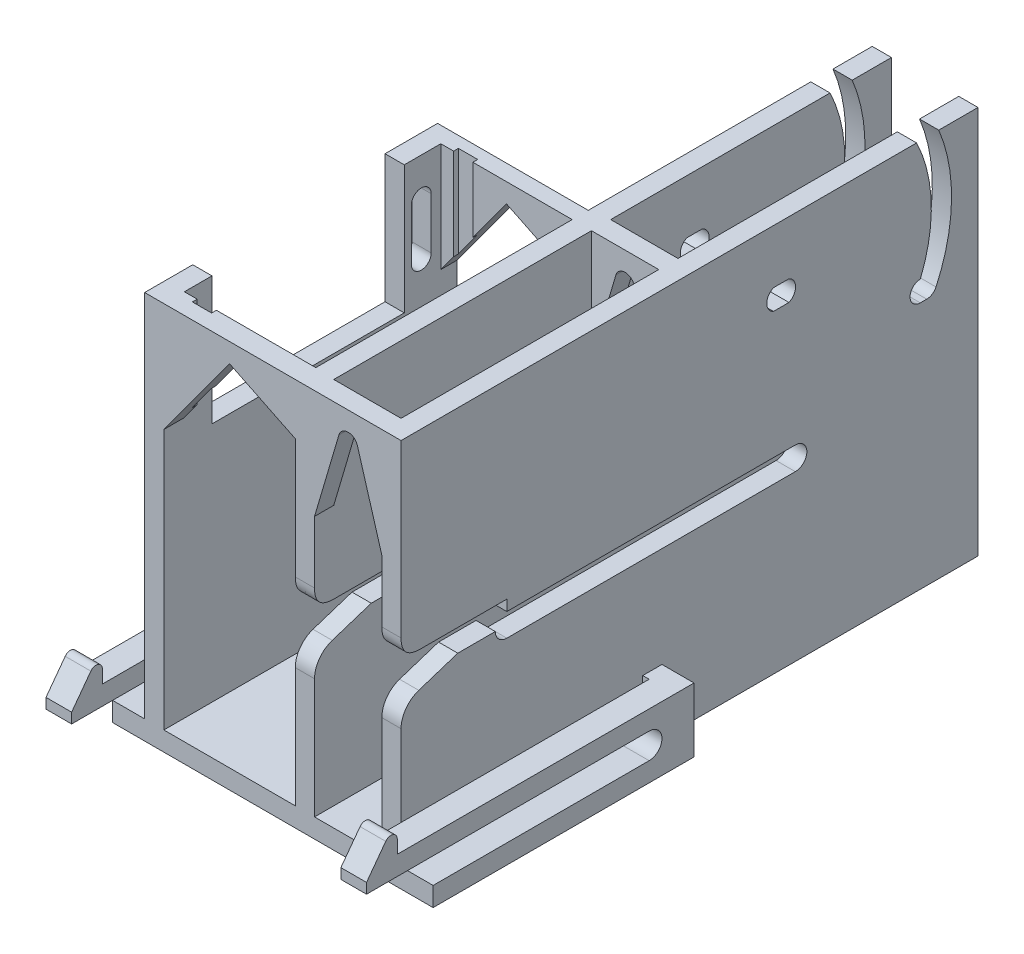
from build123d import *

# Parameters (mm, degrees)
SKETCH1_W                    = 20.5
SKETCH1_H                    = 3
SKETCH1_W_2                  = 3
SKETCH1_W_3                  = 10.5
SKETCH1_H_2                  = 2
MAIN_EXTRUDE_DEPTH           = 90
SWITCH_LEVER_START           = -16.5
SWITCH_LEVER_HOLES_DEPTH     = 16.5
SERVO_START                  = -23.5
SKETCH3_W                    = 30
SKETCH3_H                    = 20
SKETCH3_W_2                  = 44.3
SKETCH3_H_2                  = 60.6
SERVO_MOUNT_SLOTS_DEPTH      = 23.5
SERVO_HOLE_EXPANSION_REACH   = 70.75
SKETCH4_W                    = 20.5
SKETCH4_H                    = 8
SERVO_HOLE_EXPANSION_2_REACH = 115.051
SKETCH5_W                    = 20.5
SKETCH5_H                    = 40
SKETCH5_W_2                  = 10.5
SKETCH5_H_2                  = 12
SKETCH5_H_3                  = 68
TAB1_DEPTH                   = 5
TAB2_START                   = -45
TAB2_DEPTH                   = 5
TAB_SPACER_REACH             = 124.885
SKETCH7_W                    = 1
SKETCH7_H                    = 48.088
LEVER_SHELF_DEPTH            = 10.5
SKETCH10_W                   = 10.5
SKETCH10_H                   = 3.45
CUT_EXTRUDE2_DEPTH           = 45
BOSS_EXTRUDE1_DEPTH          = 3
BOSS_EXTRUDE2_START          = -43.2
BOSS_EXTRUDE2_DEPTH          = 3
FILLET1_SIZE                 = 3
CUT_EXTRUDE3_REACH           = 124.885
SKETCH12_W                   = 3
SKETCH12_H                   = 0.75
CUT_EXTRUDE4_REACH           = 116.801
FILLET2_R                    = 4


with BuildPart() as part:
    # Sketch1 → Main Extrude (new body)
    with BuildSketch(Plane.XY):
        Polygon((-8.25, 32.811469611), (-28.75, 32.811469611), (-28.75, 15.811469611), (-18.5, 29.811469611), (-8.25, 24.811469611), align=None)
        Polygon((-28.75, 15.811469611), (-28.75, 32.811469611), (-31.75, 32.811469611), (-31.75, -24.788530389), (-28.75, -24.788530389), align=None)
        with Locations((-18.5, -26.288530389)):
            Rectangle(SKETCH1_W, SKETCH1_H)
        with Locations((-30.25, -26.288530389)):
            Rectangle(SKETCH1_W_2, SKETCH1_H)
        with Locations((-6.75, -26.288530389)):
            Rectangle(SKETCH1_W_2, SKETCH1_H)
        Polygon((-5.25, 32.811469611), (-8.25, 32.811469611), (-8.25, 24.811469611), (-8.25, -24.788530389), (-5.25, -24.788530389), (-5.25, 3.911469611), (-5.25, 5.911469611), align=None)
        with Locations((0, -26.288530389)):
            Rectangle(SKETCH1_W_3, SKETCH1_H)
        with Locations((6.75, -26.288530389)):
            Rectangle(SKETCH1_W_2, SKETCH1_H)
        Polygon((5.25, 32.811469611), (5.25, 5.911469611), (5.25, 3.911469611), (5.25, -24.788530389), (8.25, -24.788530389), (8.25, 32.811469611), align=None)
        with Locations((0, 4.911469611)):
            Rectangle(SKETCH1_W_3, SKETCH1_H_2)
    extrude(amount=MAIN_EXTRUDE_DEPTH)

    # Sketch2 → Switch/Lever Holes (cut)
    with BuildSketch(Plane(origin=(8.25, 0, 0), x_dir=(0, 0, -1), z_dir=(1, 0, 0)).offset(SWITCH_LEVER_START)):
        with BuildLine():
            Line((-90, -0.338530389), (-75.3, -0.338530389))
            ThreePointArc((-75.3, -0.338530389), (-74.772792206, -1.611322596), (-73.5, -2.138530389))
            Line((-73.5, -2.138530389), (-28.5, -2.138530389))
            ThreePointArc((-28.5, -2.138530389), (-26.7, -0.338530389), (-28.5, 1.461469611))
            Line((-28.5, 1.461469611), (-73.5, 1.461469611))
            Line((-73.5, 1.461469611), (-73.5, 3.136469611))
            Line((-73.5, 3.136469611), (-90, 3.136469611))
            Line((-90, 3.136469611), (-90, -0.338530389))
        make_face()
        with BuildLine():
            Line((-29.491127656, 24.411469611), (-31.908872344, 24.411469611))
            ThreePointArc((-31.908872344, 24.411469611), (-32.95, 22.811469611), (-31.908872344, 21.211469611))
            Line((-31.908872344, 21.211469611), (-29.491127656, 21.211469611))
            ThreePointArc((-29.491127656, 21.211469611), (-28.45, 22.811469611), (-29.491127656, 24.411469611))
        make_face()
        with BuildLine():
            Line((-9, 10.911469611), (-8, 10.911469611))
            ThreePointArc((-8, 10.911469611), (-7.139020973, 11.162872148), (-6.548607336, 11.838075717))
            ThreePointArc((-6.548607336, 11.838075717), (-4.132373754, 22.279858493), (-6.120885638, 32.811469611))
            Line((-6.120885638, 32.811469611), (-9.58131915, 32.811469611))
            ThreePointArc((-9.58131915, 32.811469611), (-7.295349446, 23.52349699), (-9, 14.111469611))
            ThreePointArc((-9, 14.111469611), (-10.6, 12.511469611), (-9, 10.911469611))
        make_face()
    extrude(amount=SWITCH_LEVER_HOLES_DEPTH, mode=Mode.SUBTRACT)

    # Sketch3 → Servo Mount Slots (cut)
    with BuildSketch(Plane.ZY.offset(31.75).offset(SERVO_START)):
        with Locations((67.5, 22.811469611)):
            Rectangle(SKETCH3_W, SKETCH3_H)
        with BuildLine():
            Line((51.4, 26.811469611), (51.4, 18.811469611))
            ThreePointArc((51.4, 18.811469611), (49.85, 17.261469611), (48.3, 18.811469611))
            Line((48.3, 18.811469611), (48.3, 26.811469611))
            ThreePointArc((48.3, 26.811469611), (49.85, 28.361469611), (51.4, 26.811469611))
        make_face()
        with BuildLine():
            Line((86.7, 26.811469611), (86.7, 18.811469611))
            ThreePointArc((86.7, 18.811469611), (85.15, 17.261469611), (83.6, 18.811469611))
            Line((83.6, 18.811469611), (83.6, 26.811469611))
            ThreePointArc((83.6, 26.811469611), (85.15, 28.361469611), (86.7, 26.811469611))
        make_face()
        with Locations((22.15, 2.511469611)):
            Rectangle(SKETCH3_W_2, SKETCH3_H_2)
    extrude(amount=SERVO_MOUNT_SLOTS_DEPTH, mode=Mode.SUBTRACT)

    # Servo Hole Expansion: up to this face of the body (flat: up to its plane)
    servo_hole_expansion_end = Plane(part.part.faces().sort_by_distance((-9.616666667, 26.144802944, 83.6))[0])
    # Sketch4 → Servo Hole Expansion (cut, up to the picked face)
    with BuildSketch(Plane(origin=(0, 0, 51.4), x_dir=(-1, 0, 0), z_dir=(0, 0, -1)), mode=Mode.PRIVATE) as servo_hole_expansion_sk1:
        with Locations((18.5, 28.811469611)):
            Rectangle(SKETCH4_W, SKETCH4_H)
    servo_hole_expansion_tool1 = split(extrude(servo_hole_expansion_sk1.sketch, amount=-SERVO_HOLE_EXPANSION_REACH, mode=Mode.PRIVATE), bisect_by=servo_hole_expansion_end, keep=Keep.BOTH, mode=Mode.PRIVATE)
    add(servo_hole_expansion_tool1.solids().sort_by(Axis((-18.5, 28.81147, 51.4), (0, 0, 1)))[0], mode=Mode.SUBTRACT)

    # Servo Hole Expansion 2: up to this face of the body (flat: up to its plane)
    servo_hole_expansion_2_end = Plane(part.part.faces().sort_by_distance((-18.5, -24.788530389, 67.15))[0])
    # Sketch5 → Servo Hole Expansion 2 (cut, up to the picked face)
    with BuildSketch(Plane(origin=(0, 32.811469611, 0), x_dir=(1, 0, 0), z_dir=(0, 1, 0)), mode=Mode.PRIVATE) as servo_hole_expansion_2_sk1:
        with Locations((-18.5, -66.8)):
            Rectangle(SKETCH5_W, SKETCH5_H)
    servo_hole_expansion_2_tool1 = split(extrude(servo_hole_expansion_2_sk1.sketch, amount=-SERVO_HOLE_EXPANSION_2_REACH, mode=Mode.PRIVATE), bisect_by=servo_hole_expansion_2_end, keep=Keep.BOTH, mode=Mode.PRIVATE)
    # Sketch5 → Servo Hole Expansion 2 (cut, up to the picked face)
    with BuildSketch(Plane(origin=(0, 32.811469611, 0), x_dir=(1, 0, 0), z_dir=(0, 1, 0)), mode=Mode.PRIVATE) as servo_hole_expansion_2_sk2:
        with Locations((0, -6)):
            Rectangle(SKETCH5_W_2, SKETCH5_H_2)
    servo_hole_expansion_2_tool2 = split(extrude(servo_hole_expansion_2_sk2.sketch, amount=-SERVO_HOLE_EXPANSION_2_REACH, mode=Mode.PRIVATE), bisect_by=servo_hole_expansion_2_end, keep=Keep.BOTH, mode=Mode.PRIVATE)
    # Sketch5 → Servo Hole Expansion 2 (cut, up to the picked face)
    with BuildSketch(Plane(origin=(0, 32.811469611, 0), x_dir=(1, 0, 0), z_dir=(0, 1, 0)), mode=Mode.PRIVATE) as servo_hole_expansion_2_sk3:
        with Locations((0, -56)):
            Rectangle(SKETCH5_W_2, SKETCH5_H_3)
    servo_hole_expansion_2_tool3 = split(extrude(servo_hole_expansion_2_sk3.sketch, amount=-SERVO_HOLE_EXPANSION_2_REACH, mode=Mode.PRIVATE), bisect_by=servo_hole_expansion_2_end, keep=Keep.BOTH, mode=Mode.PRIVATE)
    add(servo_hole_expansion_2_tool1.solids().sort_by(Axis((-18.5, 32.81147, 66.8), (0, -1, 0)))[0], mode=Mode.SUBTRACT)
    add(servo_hole_expansion_2_tool2.solids().sort_by(Axis((0, 32.81147, 6), (0, -1, 0)))[0], mode=Mode.SUBTRACT)
    add(servo_hole_expansion_2_tool3.solids().sort_by(Axis((0, 32.81147, 56), (0, -1, 0)))[0], mode=Mode.SUBTRACT)

    # Sketch6 → Tab1 (add)
    with BuildSketch(Plane.ZY.offset(31.75)):
        with BuildLine():
            Line((49.3, -17.788530389), (49.3, -27.788530389))
            Line((49.3, -27.788530389), (90, -27.788530389))
            Line((90, -27.788530389), (90, -24.788530389))
            Line((90, -24.788530389), (56.3, -24.788530389))
            ThreePointArc((56.3, -24.788530389), (54.3, -22.788530389), (56.3, -20.788530389))
            Line((56.3, -20.788530389), (90, -20.788530389))
            Line((90, -20.788530389), (90, -17.788530389))
            Line((90, -17.788530389), (49.3, -17.788530389))
        make_face()
        Polygon((95.588, -17.788530389), (90, -17.788530389), (90, -20.788530389), (100.388, -20.788530389), (100.388, -19.188530389), (99.35106603, -17.788530389), align=None)
        with BuildLine():
            Line((95.588, -15.738158077), (95.588, -17.788530389))
            Line((95.588, -17.788530389), (99.35106603, -17.788530389))
            Line((99.35106603, -17.788530389), (97.391585488, -15.142968726))
            ThreePointArc((97.391585488, -15.142968726), (96.274619631, -14.788530389), (95.588, -15.738158077))
        make_face()
    extrude(amount=TAB1_DEPTH)

    # Sketch6<4> → Tab2 (add)
    with BuildSketch(Plane.ZY.offset(31.75).offset(TAB2_START)):
        with BuildLine():
            Line((49.3, -17.788530389), (49.3, -27.788530389))
            Line((49.3, -27.788530389), (90, -27.788530389))
            Line((90, -27.788530389), (90, -24.788530389))
            Line((90, -24.788530389), (56.3, -24.788530389))
            ThreePointArc((56.3, -24.788530389), (54.3, -22.788530389), (56.3, -20.788530389))
            Line((56.3, -20.788530389), (90, -20.788530389))
            Line((90, -20.788530389), (90, -17.788530389))
            Line((90, -17.788530389), (49.3, -17.788530389))
        make_face()
        Polygon((95.588, -17.788530389), (90, -17.788530389), (90, -20.788530389), (100.388, -20.788530389), (100.388, -19.188530389), (99.35106603, -17.788530389), align=None)
        with BuildLine():
            Line((95.588, -15.738158077), (95.588, -17.788530389))
            Line((95.588, -17.788530389), (99.35106603, -17.788530389))
            Line((99.35106603, -17.788530389), (97.391585488, -15.142968726))
            ThreePointArc((97.391585488, -15.142968726), (96.274619631, -14.788530389), (95.588, -15.738158077))
        make_face()
    extrude(amount=TAB2_DEPTH)

    # Tab Spacer: up to this face of the body (flat: up to its plane)
    tab_spacer_end = Plane(part.part.faces().sort_by_distance((-18.5, -24.788530389, 67.15))[0])
    # Sketch7 → Tab Spacer (cut, up to the picked face)
    with BuildSketch(Plane(origin=(0, 32.811469611, 0), x_dir=(1, 0, 0), z_dir=(0, 1, 0)), mode=Mode.PRIVATE) as tab_spacer_sk1:
        with Locations((-32.25, -76.344)):
            Rectangle(SKETCH7_W, SKETCH7_H)
    tab_spacer_tool1 = split(extrude(tab_spacer_sk1.sketch, amount=-TAB_SPACER_REACH, mode=Mode.PRIVATE), bisect_by=tab_spacer_end, keep=Keep.BOTH, mode=Mode.PRIVATE)
    # Sketch7 → Tab Spacer (cut, up to the picked face)
    with BuildSketch(Plane(origin=(0, 32.811469611, 0), x_dir=(1, 0, 0), z_dir=(0, 1, 0)), mode=Mode.PRIVATE) as tab_spacer_sk2:
        with Locations((8.75, -76.344)):
            Rectangle(SKETCH7_W, SKETCH7_H)
    tab_spacer_tool2 = split(extrude(tab_spacer_sk2.sketch, amount=-TAB_SPACER_REACH, mode=Mode.PRIVATE), bisect_by=tab_spacer_end, keep=Keep.BOTH, mode=Mode.PRIVATE)
    add(tab_spacer_tool1.solids().sort_by(Axis((-32.25, 32.81147, 76.344), (0, -1, 0)))[0], mode=Mode.SUBTRACT)
    add(tab_spacer_tool2.solids().sort_by(Axis((8.75, 32.81147, 76.344), (0, -1, 0)))[0], mode=Mode.SUBTRACT)

    # Sketch8 → Lever Shelf (cut)
    with BuildSketch(Plane(origin=(-5.25, 0, 0), x_dir=(0, 0, -1), z_dir=(1, 0, 0))):
        with BuildLine():
            Line((-22, 5.911469611), (-22, 3.911469611))
            Line((-22, 3.911469611), (-17, 3.911469611))
            ThreePointArc((-17, 3.911469611), (-19.692582404, 4.430013602), (-22, 5.911469611))
        make_face()
    extrude(amount=LEVER_SHELF_DEPTH, mode=Mode.SUBTRACT)

    # Sketch10 → Cut-Extrude2 (cut)
    with BuildSketch(Plane(origin=(0, 0, 0), x_dir=(-1, 0, 0), z_dir=(0, 0, -1))):
        with Locations((0, 4.186469611)):
            Rectangle(SKETCH10_W, SKETCH10_H)
    extrude(amount=-CUT_EXTRUDE2_DEPTH, mode=Mode.SUBTRACT)

    # Sketch11 → Boss-Extrude1 (add)
    with BuildSketch(Plane.XY.offset(90)):
        with BuildLine():
            Line((-5.25, 32.811469611), (5.25, 32.811469611))
            Line((5.25, 32.811469611), (5.25, 15.811469611))
            Line((5.25, 15.811469611), (1.438746649, 28.735743203))
            ThreePointArc((1.438746649, 28.735743203), (0, 29.811469611), (-1.438746649, 28.735743203))
            Line((-1.438746649, 28.735743203), (-5.25, 15.811469611))
            Line((-5.25, 15.811469611), (-5.25, 32.811469611))
        make_face()
    extrude(amount=-BOSS_EXTRUDE1_DEPTH)

    # Sketch11<2> → Boss-Extrude2 (add)
    with BuildSketch(Plane.XY.offset(90).offset(BOSS_EXTRUDE2_START)):
        with BuildLine():
            Line((-5.25, 32.811469611), (5.25, 32.811469611))
            Line((5.25, 32.811469611), (5.25, 15.811469611))
            Line((5.25, 15.811469611), (1.438746649, 28.735743203))
            ThreePointArc((1.438746649, 28.735743203), (0, 29.811469611), (-1.438746649, 28.735743203))
            Line((-1.438746649, 28.735743203), (-5.25, 15.811469611))
            Line((-5.25, 15.811469611), (-5.25, 32.811469611))
        make_face()
    extrude(amount=-BOSS_EXTRUDE2_DEPTH)

    # Fillet1
    # a fillet whose section is not a circle: 3 mm, written as the material it takes off along each edge
    with BuildSketch(Plane(origin=(-2.25, -0.338530389, 90), x_dir=(0, -1, 0), z_dir=(1, 0, 0)), Plane(origin=(-15.75, -0.338530389, 90), x_dir=(0, -1, 0), z_dir=(1, 0, 0))) as fillet1_piece_1:
        with BuildLine():
            Bezier((FILLET1_SIZE, 0), (0, 0), (0, FILLET1_SIZE), weights=[1, 1, 1])
            Line((0, FILLET1_SIZE), (0, 0))
            Line((0, 0), (FILLET1_SIZE, 0))
        make_face()
    extrude(amount=18, mode=Mode.SUBTRACT)
    with BuildSketch(Plane(origin=(-15.75, 3.136469611, 90), x_dir=(0, 1, 0), z_dir=(1, 0, 0)), Plane(origin=(-2.25, 3.136469611, 90), x_dir=(0, 1, 0), z_dir=(1, 0, 0))) as fillet1_piece_2:
        with BuildLine():
            Bezier((FILLET1_SIZE, 0), (0, 0), (0, -FILLET1_SIZE), weights=[1, 1, 1])
            Line((0, -FILLET1_SIZE), (0, 0))
            Line((0, 0), (FILLET1_SIZE, 0))
        make_face()
    extrude(amount=18, mode=Mode.SUBTRACT)

    # Cut-Extrude3: up to this plane
    cut_extrude3_end = Plane(origin=(-26.253505133, 19.221316258, 90), z_dir=(-0.806862820153453, 0.5907388504694919, 0))
    # Sketch12 → Cut-Extrude3 (cut, up to the surface)
    with BuildSketch(Plane(origin=(0, 32.811469611, 0), x_dir=(1, 0, 0), z_dir=(0, 1, 0)), mode=Mode.PRIVATE) as cut_extrude3_sk1:
        with Locations((-25.25, -87.175)):
            Rectangle(SKETCH12_W, SKETCH12_H)
    cut_extrude3_tool1 = split(extrude(cut_extrude3_sk1.sketch, amount=-CUT_EXTRUDE3_REACH, mode=Mode.PRIVATE), bisect_by=cut_extrude3_end, keep=Keep.BOTH, mode=Mode.PRIVATE)
    add(cut_extrude3_tool1.solids().sort_by_distance((-25.25, 32.81147, 87.175))[0], mode=Mode.SUBTRACT)
    # Sketch12 → Cut-Extrude3 (cut, up to the surface)
    with BuildSketch(Plane(origin=(0, 32.811469611, 0), x_dir=(1, 0, 0), z_dir=(0, 1, 0)), mode=Mode.PRIVATE) as cut_extrude3_sk2:
        with Locations((-25.25, -46.425)):
            Rectangle(SKETCH12_W, SKETCH12_H)
    cut_extrude3_tool2 = split(extrude(cut_extrude3_sk2.sketch, amount=-CUT_EXTRUDE3_REACH, mode=Mode.PRIVATE), bisect_by=cut_extrude3_end, keep=Keep.BOTH, mode=Mode.PRIVATE)
    add(cut_extrude3_tool2.solids().sort_by_distance((-25.25, 32.81147, 46.425))[0], mode=Mode.SUBTRACT)

    # Cut-Extrude4: up to this face of the body (flat: up to its plane)
    cut_extrude4_end = Plane(part.part.faces().sort_by_distance((-8.25, 2.844014884, 44.117576332))[0])
    # Sketch13 → Cut-Extrude4 (cut, up to the picked face)
    with BuildSketch(Plane(origin=(8.25, 0, 0), x_dir=(0, 0, -1), z_dir=(1, 0, 0)), mode=Mode.PRIVATE) as cut_extrude4_sk1:
        Polygon((-81.15, -0.338530389), (-90, -0.338530389), (-90, -3.213530389), align=None)
    cut_extrude4_tool1 = split(extrude(cut_extrude4_sk1.sketch, amount=-CUT_EXTRUDE4_REACH, mode=Mode.PRIVATE), bisect_by=cut_extrude4_end, keep=Keep.BOTH, mode=Mode.PRIVATE)
    add(cut_extrude4_tool1.solids().sort_by(Axis((8.25, -1.296864, 87.05), (-1, 0, 0)))[0], mode=Mode.SUBTRACT)

    # Fillet2
    fillet2_edges = [part.edges().sort_by_distance(p)[0] for p in [
        (6.7499997, -3.213095302, 89.998660688),
        (-6.7499997, -3.213095302, 89.998660688),
    ]]
    fillet(fillet2_edges, radius=FILLET2_R)


solid = part.part
